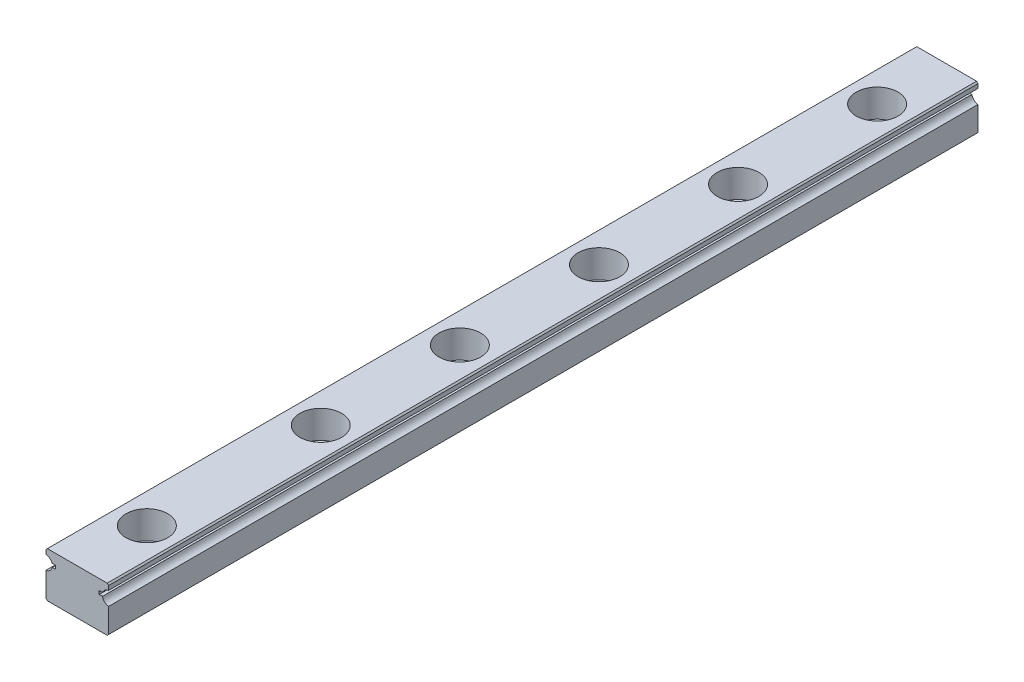
from build123d import *

# Parameters (mm, degrees)
EXTRUDE_RAIL_PROFILE_DEPTH     = 125
CBORE_FOR_M3_SHCS2_D           = 3.5
CBORE_FOR_M3_SHCS2_CBORE_D     = 6
CBORE_FOR_M3_SHCS2_CBORE_DEPTH = 4
FILL_START                     = -0.75
FILL_PATTERN_OUTLINE_R         = 3
FILL_PATTERN_DEPTH             = 4
FILL_START_2                   = -3.25
FILL_PATTERN_2_OUTLINE_R       = 1.75
FILL_PATTERN_2_DEPTH           = 2.5


# Read off the part's stored shape, not the designer's step: Fill Pattern
with BuildPart() as part:
    # Sketch1 → Extrude Rail Profile (new body)
    with BuildSketch(Plane.XY):
        with BuildLine():
            Line((-4.3, -3.25), (4.3, -3.25))
            Line((4.3, -3.25), (4.5, -3.05))
            Line((4.5, -3.05), (4.5, 0.455012563))
            ThreePointArc((4.5, 0.455012563), (3.924845827, 0.712323349), (3.617735397, 1.2625))
            Line((3.617735397, 1.2625), (3.15008224, 1.2625))
            Line((3.15008224, 1.2625), (3.15008224, 1.7625))
            Line((3.15008224, 1.7625), (3.65008224, 1.7625))
            ThreePointArc((3.65008224, 1.7625), (3.973877727, 2.229724887), (4.5, 2.444987437))
            Line((4.5, 2.444987437), (4.5, 3.05))
            Line((4.5, 3.05), (4.3, 3.25))
            Line((4.3, 3.25), (-4.3, 3.25))
            Line((-4.3, 3.25), (-4.5, 3.05))
            Line((-4.5, 3.05), (-4.5, 2.444987437))
            ThreePointArc((-4.5, 2.444987437), (-3.973877727, 2.229724887), (-3.65008224, 1.7625))
            Line((-3.65008224, 1.7625), (-3.15008224, 1.7625))
            Line((-3.15008224, 1.7625), (-3.15008224, 1.2625))
            Line((-3.15008224, 1.2625), (-3.617735397, 1.2625))
            ThreePointArc((-3.617735397, 1.2625), (-3.924845827, 0.712323349), (-4.5, 0.455012563))
            Line((-4.5, 0.455012563), (-4.5, -3.05))
            Line((-4.5, -3.05), (-4.3, -3.25))
        make_face()
    extrude(amount=EXTRUDE_RAIL_PROFILE_DEPTH)

    # CBORE for M3 SHCS2 (through all)
    with Locations(Plane(origin=(0, 3.25, 0), x_dir=(1, 0, 0), z_dir=(0, 1, 0))):
        with Locations((0, -10)):
            cbore_for_m3_shcs2 = CounterBoreHole(CBORE_FOR_M3_SHCS2_D / 2, CBORE_FOR_M3_SHCS2_CBORE_D / 2, CBORE_FOR_M3_SHCS2_CBORE_DEPTH)

    # Mirror 2: CBORE for M3 SHCS2 across plane
    add(cbore_for_m3_shcs2.mirror(Plane.XY.offset(62.5)), mode=Mode.SUBTRACT)

    # Fill Pattern outline → Fill Pattern (cut)
    with BuildSketch(Plane(origin=(0, 0, 0), x_dir=(1, 0, 0), z_dir=(0, 1, 0)).offset(FILL_START)):
        with Locations((0, -30)):
            Circle(FILL_PATTERN_OUTLINE_R)
        with Locations((0, -50)):
            Circle(FILL_PATTERN_OUTLINE_R)
        with Locations((0, -70)):
            Circle(FILL_PATTERN_OUTLINE_R)
        with Locations((0, -90)):
            Circle(FILL_PATTERN_OUTLINE_R)
    extrude(amount=FILL_PATTERN_DEPTH, mode=Mode.SUBTRACT)

    # Fill Pattern 2 outline → Fill Pattern 2 (cut)
    with BuildSketch(Plane(origin=(0, 0, 0), x_dir=(1, 0, 0), z_dir=(0, 1, 0)).offset(FILL_START_2)):
        with Locations((0, -30)):
            Circle(FILL_PATTERN_2_OUTLINE_R)
        with Locations((0, -50)):
            Circle(FILL_PATTERN_2_OUTLINE_R)
        with Locations((0, -70)):
            Circle(FILL_PATTERN_2_OUTLINE_R)
        with Locations((0, -90)):
            Circle(FILL_PATTERN_2_OUTLINE_R)
    extrude(amount=FILL_PATTERN_2_DEPTH, mode=Mode.SUBTRACT)


solid = part.part
